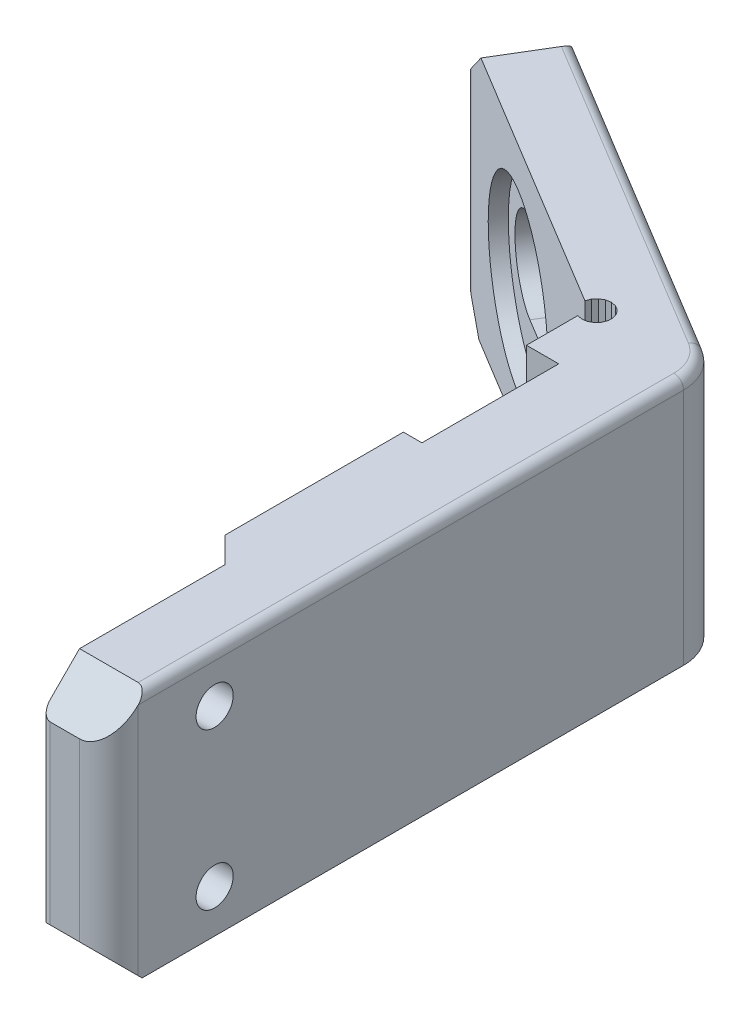
from build123d import *

# Parameters (mm, degrees)
LEG_AND_PAD_DEPTH               = 13
SCREW_HEAD_RELIEF_SKETCH_W      = 14
SCREW_HEAD_RELIEF_SKETCH_H      = 6
SCREW_HEAD_RELIEF_DEPTH         = 2.35
LENS_FRAME_RELIEF_SIDE_SKETCH_W = 2.8
LENS_FRAME_RELIEF_SIDE_SKETCH_H = 23.88
LENS_FRAME_RELIEF_SIDE_DEPTH    = 14
M6_SLOT_MIDDLE_DEPTH            = 4.5
SCREW_HOLES_SKETCH_R            = 1.9
SCREW_HOLES_DEPTH               = 4.5
LEG_TOP_CORNERS_SIZE            = 4
PAD_END_CORNERS_SIZE            = 4
OUTSIDE_OF_THE_BEND_R           = 5
LEG_TOP_OUTER_EDGE_R            = 3
PAD_END_OUTER_EDGE_R            = 3
LEG_TOP_INNER_EDGE_R            = 1
PAD_END_INNER_EDGE_R            = 1
BED_FACE_CHAMFER_SIZE           = 0.6
TOP_FACE_EDGE_R                 = 1


with BuildPart() as part:
    # leg and pad sketch → leg and pad (new, symmetric)
    with BuildSketch(Plane(origin=(0, -20.7, 0), x_dir=(1, 0, 0), z_dir=(0, 1, 0))):
        Polygon((-0.551289683, 30.332713936), (-0.367250577, 30.819395741), (-0.028023026, 31.213926146), (0.425575667, 31.468833575), (0.938966578, 31.553446481), (1.450376329, 31.457583879), (1.898269923, 31.192780366), (2.228754897, 30.790898227), (2.402065893, 30.30029363), (2.397349395, 29.779998208), (2.215172912, 29.292616119), (1.877456693, 28.896791249), (1.424836191, 28.640150931), (0.91177263, 28.55357522), (0.4, 28.647481273), (0.4, -7.48), (4.42, -11.5), (4.42, -30.37), (11.42, -30.37), (11.42, 31.283844582), (-27.204821487, 54.594667874), (-30.821788068, 48.601542416), align=None)
    extrude(amount=LEG_AND_PAD_DEPTH, both=True)

    # screw head relief sketch → screw head relief (cut, symmetric)
    with BuildSketch(Plane(origin=(1.35, 0, 0), x_dir=(0, 0, -1), z_dir=(1, 0, 0))):
        with Locations((16.4, -9.7)):
            Rectangle(SCREW_HEAD_RELIEF_SKETCH_W, SCREW_HEAD_RELIEF_SKETCH_H)
    extrude(amount=SCREW_HEAD_RELIEF_DEPTH, both=True, mode=Mode.SUBTRACT)

    # lens frame relief, side sketch → lens frame relief, side (cut, symmetric)
    with BuildSketch(Plane(origin=(0, -20.7, 0), x_dir=(1, 0, 0), z_dir=(0, 1, 0))):
        with Locations((0.4, 3.06)):
            Rectangle(LENS_FRAME_RELIEF_SIDE_SKETCH_W, LENS_FRAME_RELIEF_SIDE_SKETCH_H)
    extrude(amount=LENS_FRAME_RELIEF_SIDE_DEPTH, both=True, mode=Mode.SUBTRACT)

    # insert flange relief sketch → insert flange relief (revolve, cut)
    with BuildSketch(Plane(origin=(0, -20.7, 0), x_dir=(1, 0, 0), z_dir=(0, 1, 0))):
        Polygon((-18.324853729, 39.891397061), (-17.03307995, 42.03179901), (-9.327632933, 37.381413406), (-10.619406712, 35.241011457), align=None)
    revolve(axis=Axis((-18.324853729, -20.7, -39.891397061), (0.5167095115681243, 0, -0.8561607796757748)), mode=Mode.SUBTRACT)

    # M6 slot end 1 sketch → M6 slot end 1 (revolve, cut)
    with BuildSketch(Plane(origin=(0, -20.7, 0), x_dir=(1, 0, 0), z_dir=(0, 1, 0))):
        Polygon((-20.465255678, 41.18317084), (-15.814870074, 48.888617857), (-11.962146565, 46.563425055), (-16.612532169, 38.857978038), align=None)
    revolve(axis=Axis((-20.465255678, -20.7, -41.18317084), (0.5167095115681236, 0, -0.8561607796757752)), mode=Mode.SUBTRACT)

    # M6 slot end 2 sketch → M6 slot end 2 (revolve, cut)
    with BuildSketch(Plane(origin=(0, -20.7, 0), x_dir=(1, 0, 0), z_dir=(0, 1, 0))):
        Polygon((-16.18445178, 38.599623282), (-11.534066176, 46.305070299), (-7.681342667, 43.979877497), (-12.331728271, 36.27443048), align=None)
    revolve(axis=Axis((-16.18445178, -20.7, -38.599623282), (0.5167095115681234, 0, -0.8561607796757752)), mode=Mode.SUBTRACT)

    # M6 slot middle sketch → M6 slot middle (cut, symmetric)
    with BuildSketch(Plane(origin=(0, -20.7, 0), x_dir=(1, 0, 0), z_dir=(0, 1, 0))):
        Polygon((-16.18445178, 38.599623282), (-20.465255678, 41.18317084), (-15.814870074, 48.888617857), (-11.534066176, 46.305070299), align=None)
    extrude(amount=M6_SLOT_MIDDLE_DEPTH, both=True, mode=Mode.SUBTRACT)

    # screw holes sketch → screw holes (cut, symmetric)
    with BuildSketch(Plane(origin=(7.92, 0, 0), x_dir=(0, 0, -1), z_dir=(1, 0, 0))):
        with Locations((-19.54, -28.7)):
            Circle(SCREW_HOLES_SKETCH_R)
        with Locations((-19.54, -12.7)):
            Circle(SCREW_HOLES_SKETCH_R)
    extrude(amount=SCREW_HOLES_DEPTH, both=True, mode=Mode.SUBTRACT)

    # leg top corners
    leg_top_corners_edges = [part.edges().sort_by_distance(p)[0] for p in [
        (7.92, -7.7, 30.37),
        (7.92, -33.7, 30.37),
    ]]
    chamfer(leg_top_corners_edges, length=LEG_TOP_CORNERS_SIZE)

    # pad end corners
    pad_end_corners_edges = [part.edges().sort_by_distance(p)[0] for p in [
        (-29.013304778, -7.7, -51.598105145),
        (-29.013304778, -33.7, -51.598105145),
    ]]
    chamfer(pad_end_corners_edges, length=PAD_END_CORNERS_SIZE)

    # outside of the bend
    outside_of_the_bend_edges = [part.edges().sort_by_distance(p)[0] for p in [
        (11.42, -20.7, -31.283844582),
    ]]
    fillet(outside_of_the_bend_edges, radius=OUTSIDE_OF_THE_BEND_R)

    # leg top outer edge
    leg_top_outer_edge_edges = [part.edges().sort_by_distance(p)[0] for p in [
        (11.42, -20.7, 30.37),
    ]]
    fillet(leg_top_outer_edge_edges, radius=LEG_TOP_OUTER_EDGE_R)

    # pad end outer edge
    pad_end_outer_edge_edges = [part.edges().sort_by_distance(p)[0] for p in [
        (-27.204821487, -20.7, -54.594667874),
    ]]
    fillet(pad_end_outer_edge_edges, radius=PAD_END_OUTER_EDGE_R)

    # leg top inner edge
    leg_top_inner_edge_edges = [part.edges().sort_by_distance(p)[0] for p in [
        (4.42, -20.7, 30.37),
    ]]
    fillet(leg_top_inner_edge_edges, radius=LEG_TOP_INNER_EDGE_R)

    # pad end inner edge
    pad_end_inner_edge_edges = [part.edges().sort_by_distance(p)[0] for p in [
        (-30.821788068, -20.7, -48.601542416),
    ]]
    fillet(pad_end_inner_edge_edges, radius=PAD_END_INNER_EDGE_R)

    # bed face chamfer
    bed_face_chamfer_edges = [part.edges().sort_by_distance(p)[0] for p in [
        (-13.974217317, -33.7, -38.433709153),
        (-7.388315405, -33.7, -42.635024987),
        (4.42, -33.7, 18.935),
        (1.8, -33.7, -3.06),
        (0.4, -33.7, -21.823740636),
        (10.774178326, -33.7, -30.919287503),
        (11.42, -33.7, -1.045708124),
    ]]
    chamfer(bed_face_chamfer_edges, length=BED_FACE_CHAMFER_SIZE)

    # top face edge
    top_face_edge_edges = [part.edges().sort_by_distance(p)[0] for p in [
        (-7.388315405, -7.7, -42.635024987),
        (10.774178326, -7.7, -30.919287503),
        (11.42, -7.7, -1.045708124),
    ]]
    fillet(top_face_edge_edges, radius=TOP_FACE_EDGE_R)


solid = part.part
